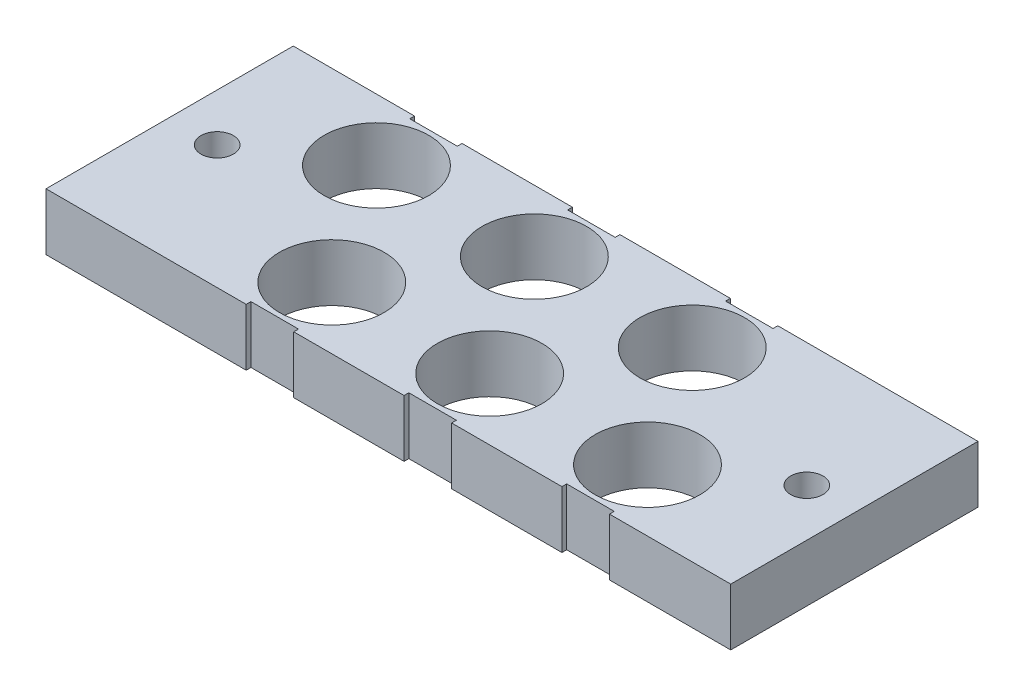
from build123d import *

# Parameters (mm, degrees)
SKETCH1_W             = 12
SKETCH1_H             = 12
SKETCH1_R             = 5.5
BOSS_EXTRUDE1_DEPTH   = 6
BOSS_EXTRUDE1_2_DEPTH = 6
BOSS_EXTRUDE1_3_DEPTH = 6
BOSS_EXTRUDE1_4_DEPTH = 6
BOSS_EXTRUDE1_5_DEPTH = 6
BOSS_EXTRUDE1_6_DEPTH = 6
SKETCH1_3_R           = 1.7
BOSS_EXTRUDE2_DEPTH   = 6
CUT_EXTRUDE1_DEPTH    = 1


with BuildPart() as part:
    # Sketch1 → Boss-Extrude1 (new body)
    with BuildSketch(Plane(origin=(0, 0, 0), x_dir=(1, 0, 0), z_dir=(0, 1, 0))):
        with Locations((11.886385948, -10.664884408)):
            Rectangle(SKETCH1_W, SKETCH1_H)
        with Locations((11.886385948, -10.664884408)):
            Circle(SKETCH1_R, mode=Mode.SUBTRACT)
    extrude(amount=-BOSS_EXTRUDE1_DEPTH)



with BuildPart() as body_2:
    # Sketch1 → Boss-Extrude1 2 (new body)
    with BuildSketch(Plane(origin=(0, 0, 0), x_dir=(1, 0, 0), z_dir=(0, 1, 0))):
        with Locations((-4.713614052, -10.664885052)):
            Rectangle(SKETCH1_W, SKETCH1_H)
        with Locations((-4.713614052, -10.664885052)):
            Circle(SKETCH1_R, mode=Mode.SUBTRACT)
    extrude(amount=-BOSS_EXTRUDE1_2_DEPTH)


with BuildPart() as body_3:
    # Sketch1 → Boss-Extrude1 3 (new body)
    with BuildSketch(Plane(origin=(0, 0, 0), x_dir=(1, 0, 0), z_dir=(0, 1, 0))):
        with Locations((3.586385956, -23.664883973)):
            Rectangle(SKETCH1_W, SKETCH1_H)
        with Locations((3.586385956, -23.664883973)):
            Circle(SKETCH1_R, mode=Mode.SUBTRACT)
    extrude(amount=-BOSS_EXTRUDE1_3_DEPTH)


with BuildPart() as body_4:
    # Sketch1 → Boss-Extrude1 4 (new body)
    with BuildSketch(Plane(origin=(0, 0, 0), x_dir=(1, 0, 0), z_dir=(0, 1, 0))):
        with Locations((20.186385956, -23.664884408)):
            Rectangle(SKETCH1_W, SKETCH1_H)
        with Locations((20.186385956, -23.664884408)):
            Circle(SKETCH1_R, mode=Mode.SUBTRACT)
    extrude(amount=-BOSS_EXTRUDE1_4_DEPTH)


with BuildPart() as body_5:
    # Sketch1 → Boss-Extrude1 5 (new body)
    with BuildSketch(Plane(origin=(0, 0, 0), x_dir=(1, 0, 0), z_dir=(0, 1, 0))):
        with Locations((28.486385948, -10.664884408)):
            Rectangle(SKETCH1_W, SKETCH1_H)
        with Locations((28.486385948, -10.664884408)):
            Circle(SKETCH1_R, mode=Mode.SUBTRACT)
    extrude(amount=-BOSS_EXTRUDE1_5_DEPTH)


with BuildPart() as body_6:
    # Sketch1 → Boss-Extrude1 6 (new body)
    with BuildSketch(Plane(origin=(0, 0, 0), x_dir=(1, 0, 0), z_dir=(0, 1, 0))):
        with Locations((36.786385956, -23.66488461)):
            Rectangle(SKETCH1_W, SKETCH1_H)
        with Locations((36.786385956, -23.66488461)):
            Circle(SKETCH1_R, mode=Mode.SUBTRACT)
    extrude(amount=-BOSS_EXTRUDE1_6_DEPTH)


with BuildPart() as part_1:
    add(part.part)

    add(body_2.part)  # Boss-Extrude2 merges body 2

    add(body_3.part)  # Boss-Extrude2 merges body 3

    add(body_4.part)  # Boss-Extrude2 merges body 4

    add(body_5.part)  # Boss-Extrude2 merges body 5

    add(body_6.part)  # Boss-Extrude2 merges body 6
    # Sketch1<3> → Boss-Extrude2 (add)
    with BuildSketch(Plane(origin=(0, 0, 0), x_dir=(1, 0, 0), z_dir=(0, 1, 0))):
        Polygon((5.386385948, -4.164884408), (1.786385948, -4.164885052), (-2.213614052, -4.164885052), (-2.213614052, -4.664885052), (1.286385948, -4.664885052), (1.286385948, -16.664885052), (-10.713614052, -16.664885052), (-10.713614052, -4.664885052), (-7.213614052, -4.664885052), (-7.213614052, -4.164885052), (-19.963614052, -4.164885052), (-19.963614052, -30.164883973), (1.086385956, -30.164883973), (1.086385956, -29.664883973), (-2.413614044, -29.664883973), (-2.413614044, -17.664883973), (9.586385956, -17.664883973), (9.586385956, -29.664883973), (6.086385956, -29.664883973), (6.086385956, -30.164883973), (10.086385956, -30.164883973), (13.686385956, -30.164884408), (17.686385956, -30.164884408), (17.686385956, -29.664884408), (14.186385956, -29.664884408), (14.186385956, -17.664884408), (26.186385956, -17.664884408), (26.186385956, -29.664884408), (22.686385956, -29.664884408), (22.686385956, -30.164884408), (26.686385956, -30.164884408), (30.286385956, -30.16488461), (34.286385956, -30.16488461), (34.286385956, -29.66488461), (30.786385956, -29.66488461), (30.786385956, -17.66488461), (42.786385956, -17.66488461), (42.786385956, -29.66488461), (39.286385956, -29.66488461), (39.286385956, -30.16488461), (43.286385956, -30.16488461), (52.036385956, -30.164883973), (52.036385956, -4.164885052), (34.986385948, -4.164884408), (30.986385948, -4.164884408), (30.986385948, -4.664884408), (34.486385948, -4.664884408), (34.486385948, -16.664884408), (22.486385948, -16.664884408), (22.486385948, -4.664884408), (25.986385948, -4.664884408), (25.986385948, -4.164884408), (14.386385948, -4.164884408), (14.386385948, -4.664884408), (17.886385948, -4.664884408), (17.886385948, -16.664884408), (5.886385948, -16.664884408), (5.886385948, -4.664884408), (9.386385948, -4.664884408), (9.386385948, -4.164884408), align=None)
        with Locations((-14.963614052, -17.164884513)):
            Circle(SKETCH1_3_R, mode=Mode.SUBTRACT)
        with Locations((47.036385956, -17.164884513)):
            Circle(SKETCH1_3_R, mode=Mode.SUBTRACT)
    extrude(amount=-BOSS_EXTRUDE2_DEPTH)

    # Sketch2 → Cut-Extrude1 (cut)
    # profile 1 of 2: a face of its own
    with BuildSketch(Plane(origin=(0, -6, 0), x_dir=(-1, 0, 0), z_dir=(0, -1, 0))):
        Polygon((8.920160293, -23.584386496), (10.466955165, -23.584386496), (10.466955165, -23.910027522), (9.205096191, -23.910027522), (9.205096191, -24.886950599), (10.466955165, -24.886950599), (10.466955165, -25.212591624), (9.205096191, -25.212591624), (9.205096191, -26.759386496), (8.920160293, -26.759386496), align=None)
    # profile 2 of 2: a face of its own
    with BuildSketch(Plane(origin=(0, -6, 0), x_dir=(-1, 0, 0), z_dir=(0, -1, 0))):
        with BuildLine():
            add(Edge.make_bspline(
                [(12.295505846, -24.990621472), (12.321494171, -25.004172332), (12.372180084, -25.030601035), (12.44436798, -25.073155857), (12.510339945, -25.118005875), (12.571926384, -25.163032691), (12.62804528, -25.209960689), (12.678069141, -25.25897648), (12.723233624, -25.308856588), (12.762627921, -25.360445657), (12.797277909, -25.413606632), (12.827224632, -25.468479044), (12.852821666, -25.524942639), (12.873108046, -25.583613764), (12.889819242, -25.643630572), (12.901317827, -25.705768027), (12.907501745, -25.769616679), (12.908670883, -25.812767924), (12.909262857, -25.834616865)],
                knots=[0, 0, 0, 0, 1.272397273, 2.481599622, 3.635517121, 4.734568067, 5.792894095, 6.808321871, 7.773003508, 8.711915296, 9.623354172, 10.525449501, 11.423591555, 12.311487226, 13.218079475, 14.126165749, 15.051214107, 16, 16, 16, 16], degree=3))
            add(Edge.make_bspline(
                [(12.909262857, -25.834616865), (12.908563069, -25.865185522), (12.907177925, -25.925692365), (12.895112939, -26.014997052), (12.877049023, -26.101730597), (12.850669751, -26.185873985), (12.816458318, -26.266962917), (12.774297188, -26.345066804), (12.726571309, -26.421465749), (12.688242492, -26.468473349), (12.668848194, -26.492259092)],
                knots=[0, 0, 0, 0, 1.025265484, 2.029385089, 3.018602448, 3.995076438, 4.983346944, 5.966715145, 6.97116228, 8, 8, 8, 8], degree=3))
            add(Edge.make_bspline(
                [(12.668848194, -26.492259092), (12.643596535, -26.520012016), (12.593405259, -26.575174913), (12.507423604, -26.646794576), (12.413060895, -26.706982955), (12.310682264, -26.756033888), (12.200561379, -26.794211774), (12.082721704, -26.821646059), (11.956933508, -26.837359976), (11.870477831, -26.839631453), (11.826124837, -26.840796753)],
                knots=[0, 0, 0, 0, 0.954267603, 1.896743057, 2.838368354, 3.796610408, 4.779680527, 5.799409237, 6.871065594, 8, 8, 8, 8], degree=3))
            add(Edge.make_bspline(
                [(11.826124837, -26.840796753), (11.783476977, -26.83975129), (11.700488574, -26.837716927), (11.579695356, -26.823933407), (11.467098, -26.799778128), (11.362041815, -26.766717661), (11.265160143, -26.723709811), (11.176729044, -26.670180755), (11.095472655, -26.608285089), (11.023856925, -26.536245175), (10.960276694, -26.459085534), (10.904425674, -26.379482288), (10.858003475, -26.297428171), (10.81869961, -26.214146681), (10.788611475, -26.128470527), (10.767772398, -26.040840515), (10.754537806, -25.951409707), (10.75277692, -25.891055993), (10.751891063, -25.860693588)],
                knots=[0, 0, 0, 0, 1.256902934, 2.445805442, 3.576955095, 4.645999104, 5.686449165, 6.692658513, 7.68621702, 8.689161843, 9.678783111, 10.630372946, 11.551080876, 12.453998257, 13.34127905, 14.221779781, 15.105423033, 16, 16, 16, 16], degree=3))
            add(Edge.make_bspline(
                [(10.751891063, -25.860693588), (10.752415283, -25.838414892), (10.753451328, -25.794384326), (10.760622155, -25.729333721), (10.772150545, -25.666018656), (10.787807338, -25.604205267), (10.80902634, -25.54434357), (10.83464599, -25.486149926), (10.864519975, -25.429558636), (10.899065032, -25.374260222), (10.939253297, -25.321029522), (10.984758893, -25.268963155), (11.036491317, -25.218869033), (11.09387505, -25.170135119), (11.156254311, -25.121896914), (11.225249357, -25.07676136), (11.299031157, -25.031533064), (11.351468918, -25.004492654), (11.378368426, -24.990621472)],
                knots=[0, 0, 0, 0, 0.941657376, 1.861047343, 2.762797495, 3.66048619, 4.553285746, 5.444104102, 6.34607688, 7.256116206, 8.197091036, 9.162375105, 10.176350973, 11.237807142, 12.343728897, 13.50695164, 14.721116704, 16, 16, 16, 16], degree=3))
            add(Edge.make_bspline(
                [(11.378368426, -24.990621472), (11.341546251, -24.970542075), (11.270248212, -24.931662742), (11.175842362, -24.860228139), (11.094752297, -24.782859907), (11.029206946, -24.697924307), (10.97761571, -24.608074643), (10.942220262, -24.513873071), (10.91827488, -24.417066311), (10.915902858, -24.350929975), (10.914711575, -24.317714821)],
                knots=[0, 0, 0, 0, 1.166880483, 2.259407225, 3.286803203, 4.280235371, 5.237608625, 6.161067461, 7.076446754, 8, 8, 8, 8], degree=3))
            add(Edge.make_bspline(
                [(10.914711575, -24.317714821), (10.916195139, -24.283880608), (10.91917736, -24.215867938), (10.943292229, -24.11462524), (10.982589718, -24.015187356), (11.03603948, -23.918036245), (11.102612168, -23.826459979), (11.182482964, -23.744326406), (11.273744526, -23.672379562), (11.375941305, -23.611985462), (11.48591989, -23.562833143), (11.601957726, -23.528925574), (11.722033044, -23.506758525), (11.803764547, -23.504248774), (11.845205365, -23.50297624)],
                knots=[0, 0, 0, 0, 0.888701115, 1.786444228, 2.72001202, 3.692817113, 4.693886446, 5.687152267, 6.695133018, 7.739871481, 8.800368666, 9.853104506, 10.91144658, 12, 12, 12, 12], degree=3))
            add(Edge.make_bspline(
                [(11.845205365, -23.50297624), (11.885576683, -23.50428828), (11.965184323, -23.506875473), (12.082200878, -23.528453569), (12.194164874, -23.564493919), (12.300690205, -23.6133864), (12.399869828, -23.67360884), (12.487501923, -23.746543918), (12.564910765, -23.828315182), (12.628940894, -23.919863679), (12.681702944, -24.016641484), (12.718443047, -24.117899056), (12.741985195, -24.221448559), (12.744954604, -24.291514463), (12.746442345, -24.326619068)],
                knots=[0, 0, 0, 0, 1.072916533, 2.115669174, 3.151510826, 4.193348718, 5.225979165, 6.227137561, 7.216255879, 8.211077061, 9.189680878, 10.138522389, 11.067357538, 12, 12, 12, 12], degree=3))
            add(Edge.make_bspline(
                [(12.746442345, -24.326619068), (12.745140993, -24.361069328), (12.742585213, -24.428727679), (12.721085982, -24.527358165), (12.684878905, -24.619725301), (12.635444914, -24.706877193), (12.57101465, -24.787233266), (12.492448157, -24.861815349), (12.400371816, -24.931236115), (12.331192298, -24.970412317), (12.295505846, -24.990621472)],
                knots=[0, 0, 0, 0, 0.975232327, 1.915300861, 2.843280834, 3.77672583, 4.742871857, 5.749627742, 6.839139064, 8, 8, 8, 8], degree=3))
        make_face()
        with BuildLine():
            add(Edge.make_bspline(
                [(11.829304925, -23.828617265), (11.807033837, -23.829208215), (11.76346185, -23.830364371), (11.699572984, -23.836404706), (11.638819479, -23.848155124), (11.580566575, -23.863793098), (11.525612938, -23.88491863), (11.473212235, -23.909769817), (11.424256284, -23.939983177), (11.378154102, -23.97387512), (11.336651614, -24.011152257), (11.299817485, -24.049990416), (11.269221267, -24.091152379), (11.243239689, -24.133614248), (11.224387884, -24.178636271), (11.210268837, -24.224838123), (11.200724432, -24.27280365), (11.200009249, -24.305584628), (11.199647473, -24.322166945)],
                knots=[0, 0, 0, 0, 1.203892937, 2.355340988, 3.463153438, 4.544400666, 5.610487187, 6.640501085, 7.674077295, 8.714426146, 9.728707835, 10.68524104, 11.601827946, 12.495867327, 13.368432065, 14.231010473, 15.105153427, 16, 16, 16, 16], degree=3))
            add(Edge.make_bspline(
                [(11.199647473, -24.322166945), (11.200271013, -24.338749979), (11.201503217, -24.371520435), (11.211032869, -24.419912757), (11.225235873, -24.46746667), (11.247597545, -24.513051425), (11.274418455, -24.558248329), (11.307521437, -24.60192779), (11.346972198, -24.644241817), (11.391447091, -24.68483051), (11.439898986, -24.722838674), (11.491228796, -24.755834346), (11.544792308, -24.783442432), (11.600039186, -24.80641982), (11.657532491, -24.824281406), (11.716919935, -24.836952964), (11.778211498, -24.844828776), (11.819741025, -24.845769502), (11.840753242, -24.846245471)],
                knots=[0, 0, 0, 0, 0.873023192, 1.725219244, 2.590779336, 3.480155217, 4.391973325, 5.357036234, 6.360879153, 7.436073238, 8.526419356, 9.601555421, 10.645666583, 11.697338044, 12.750135903, 13.812665442, 14.89329948, 16, 16, 16, 16], degree=3))
            add(Edge.make_bspline(
                [(11.840753242, -24.846245471), (11.867740836, -24.845453655), (11.92144947, -24.843877846), (12.000624292, -24.829226424), (12.077606834, -24.806179627), (12.151574268, -24.774647372), (12.220611999, -24.73507067), (12.282152633, -24.687687861), (12.335671243, -24.63359303), (12.380611653, -24.573628315), (12.415454871, -24.509809374), (12.442580082, -24.445764823), (12.458419899, -24.38081137), (12.460485978, -24.337298482), (12.461506447, -24.315806769)],
                knots=[0, 0, 0, 0, 1.076279235, 2.141928126, 3.20205304, 4.278698113, 5.344010996, 6.36967002, 7.368914609, 8.37248503, 9.349703398, 10.264243087, 11.142681841, 12, 12, 12, 12], degree=3))
            add(Edge.make_bspline(
                [(12.461506447, -24.315806769), (12.46102394, -24.300722765), (12.460066233, -24.270783179), (12.452174039, -24.226570519), (12.439133105, -24.183363682), (12.421477311, -24.140805737), (12.398245568, -24.099493787), (12.370700913, -24.058778414), (12.337241401, -24.019575543), (12.299688922, -23.980971581), (12.25710273, -23.945244645), (12.209564895, -23.913826015), (12.157319136, -23.887144806), (12.100364217, -23.865474293), (12.038909893, -23.849198018), (11.973239214, -23.837009331), (11.902804608, -23.830139437), (11.854336191, -23.829135661), (11.829304925, -23.828617265)],
                knots=[0, 0, 0, 0, 0.814439003, 1.616544685, 2.417341072, 3.248991801, 4.09997495, 4.973547432, 5.9003056, 6.880240646, 7.880314356, 8.896779544, 9.951930927, 11.043077905, 12.18215768, 13.381699519, 14.647792085, 16, 16, 16, 16], degree=3))
        make_face(mode=Mode.SUBTRACT)
        with BuildLine():
            add(Edge.make_bspline(
                [(11.847749436, -25.171886496), (11.819513902, -25.172388728), (11.764122674, -25.173373984), (11.68297246, -25.184340888), (11.605091375, -25.199607552), (11.530742004, -25.22276767), (11.459955744, -25.252881629), (11.392349397, -25.289107961), (11.328440158, -25.331930042), (11.269110542, -25.380803829), (11.21493295, -25.433472048), (11.167400206, -25.489226985), (11.127034598, -25.547032425), (11.094528721, -25.607622519), (11.067848078, -25.66971428), (11.050327632, -25.734854027), (11.039095651, -25.80178948), (11.037587407, -25.847291855), (11.03682696, -25.870233852)],
                knots=[0, 0, 0, 0, 1.140299081, 2.23698856, 3.303958914, 4.344563908, 5.37730929, 6.408454204, 7.439741482, 8.480804886, 9.510774543, 10.48932336, 11.43758569, 12.353841022, 13.263987381, 14.161954604, 15.073269652, 16, 16, 16, 16], degree=3))
            add(Edge.make_bspline(
                [(11.03682696, -25.870233852), (11.038063631, -25.898746174), (11.040517156, -25.955313955), (11.059981392, -26.038919026), (11.091219342, -26.119855269), (11.134785074, -26.197463112), (11.188730658, -26.26998928), (11.255066811, -26.333206955), (11.329670999, -26.389378582), (11.415067481, -26.43480878), (11.50834759, -26.471089827), (11.609486515, -26.496087022), (11.717032763, -26.512634623), (11.791291107, -26.514302116), (11.829304925, -26.515155727)],
                knots=[0, 0, 0, 0, 0.898778495, 1.783155532, 2.693654817, 3.627872908, 4.583023416, 5.533784346, 6.509005473, 7.520592997, 8.575161974, 9.658835044, 10.801527049, 12, 12, 12, 12], degree=3))
            add(Edge.make_bspline(
                [(11.829304925, -26.515155727), (11.859014187, -26.514585308), (11.916897357, -26.513473949), (12.001339611, -26.503663839), (12.081027166, -26.488106679), (12.15580549, -26.46547932), (12.226511687, -26.437856841), (12.291946944, -26.402322167), (12.353794608, -26.361906846), (12.409007062, -26.313956946), (12.459292902, -26.262721976), (12.503138103, -26.208483866), (12.541199596, -26.152716685), (12.571072677, -26.094160174), (12.59495435, -26.033937758), (12.612120717, -25.971494116), (12.622712713, -25.906637726), (12.623783954, -25.86264214), (12.62432696, -25.840341023)],
                knots=[0, 0, 0, 0, 1.224942928, 2.386581632, 3.501229538, 4.569074225, 5.605009692, 6.626002462, 7.634866581, 8.645888296, 9.63523824, 10.59253846, 11.518950513, 12.414518923, 13.29783783, 14.186679152, 15.080837789, 16, 16, 16, 16], degree=3))
            add(Edge.make_bspline(
                [(12.62432696, -25.840341023), (12.623505226, -25.818680864), (12.62188491, -25.775970815), (12.611600911, -25.712682608), (12.593534366, -25.651538627), (12.568744513, -25.591803264), (12.535741782, -25.534686873), (12.496875365, -25.478701489), (12.449981414, -25.425401), (12.396992845, -25.374371406), (12.339245073, -25.327185702), (12.277861306, -25.285444033), (12.213314044, -25.250290327), (12.145739874, -25.221700364), (12.075288841, -25.199214588), (12.002012764, -25.183506506), (11.92582585, -25.173619009), (11.874068931, -25.172470525), (11.847749436, -25.171886496)],
                knots=[0, 0, 0, 0, 0.917430815, 1.809013306, 2.70690318, 3.612392954, 4.541220862, 5.495268465, 6.494511384, 7.542276156, 8.608045339, 9.649016899, 10.681629292, 11.715607085, 12.752076957, 13.808767841, 14.885711793, 16, 16, 16, 16], degree=3))
        make_face(mode=Mode.SUBTRACT)
    extrude(amount=-CUT_EXTRUDE1_DEPTH, mode=Mode.SUBTRACT)


solid = part_1.part
